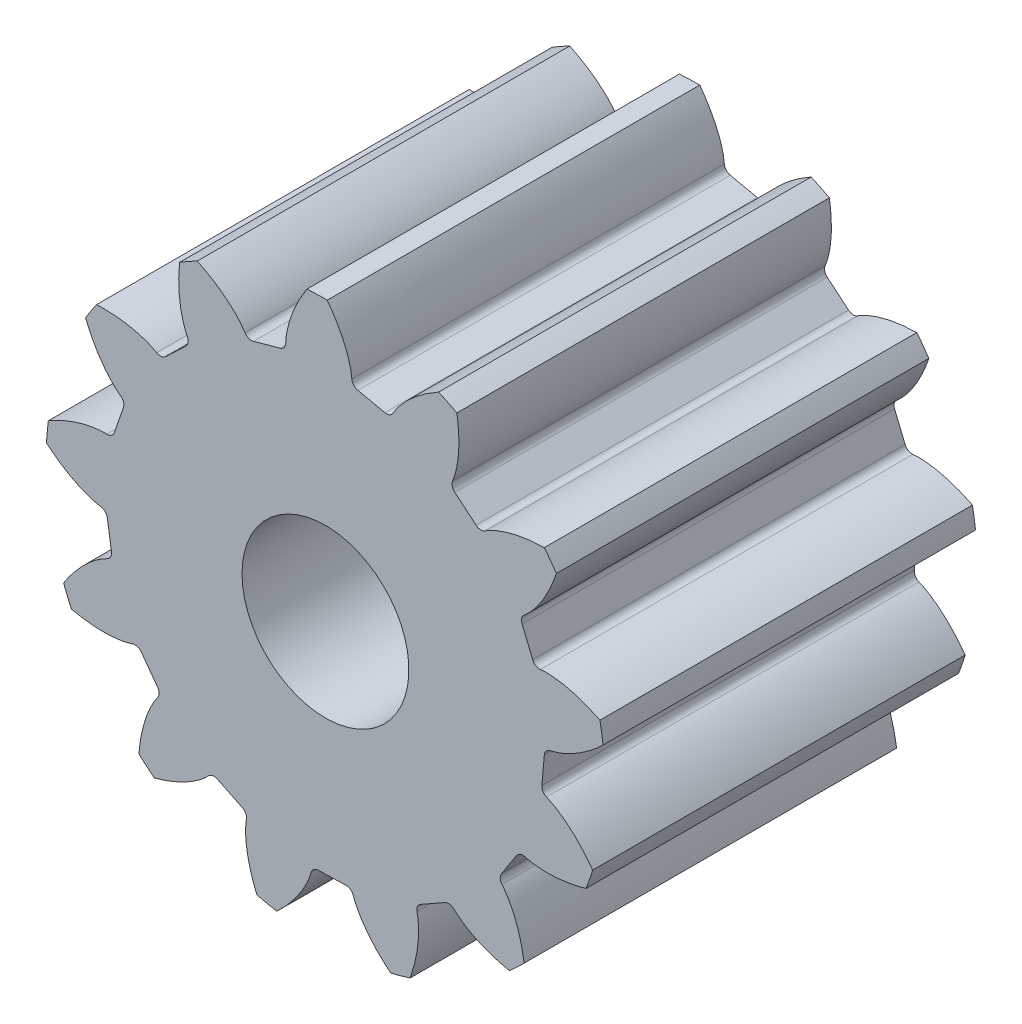
from build123d import *

# Parameters (mm, degrees)
SKETCH2_R                = 9.375
BOSS_EXTRUDE1_DEPTH      = 12.5
CUT_EXTRUDE1_DEPTH       = 12.5
FILLET1_R                = 0.254
CIRPATTERN3_COUNT        = 13
FILLET1_OF_CIRPATTERN3_R = 0.254
SKETCH3_R                = 2.8
CUT_EXTRUDE2_DEPTH       = 19.214569283


# Read off the part's stored shape, not the designer's step: Cut-Extrude1
with BuildPart() as part:
    # Sketch2 → Boss-Extrude1 (new body)
    with BuildSketch(Plane.XY):
        Circle(SKETCH2_R)
    extrude(amount=BOSS_EXTRUDE1_DEPTH)

    # Cut-Extrude1 outline → Cut-Extrude1 (cut)
    with BuildSketch(Plane.XY):
        with BuildLine():
            add(Edge.make_bspline(
                [(7.36375077, 0), (7.369196033, 0), (7.384464311, 0.000356691), (7.413295798, 0.002439252), (7.460189767, 0.007832738), (7.519640422, 0.017627369), (7.595991175, 0.033624104), (7.685169914, 0.056732319), (7.782202271, 0.086557444), (7.886545951, 0.123735009), (7.989429071, 0.164967118), (8.09080677, 0.209905809), (8.190585497, 0.258078866), (8.30989291, 0.320396761), (8.450705961, 0.400603876), (8.611688186, 0.502157362), (8.789753203, 0.626416136), (8.965954099, 0.762460936), (9.117866368, 0.889741099), (9.225406591, 0.987220267), (9.289799065, 1.047779957), (9.313674205, 1.070559573)],
                knots=[0, 0, 0, 0, 0, 0.005376748, 0.015083688, 0.02853182, 0.046610139, 0.064854849, 0.092110525, 0.119476175, 0.146842495, 0.174208853, 0.201574955, 0.228941013, 0.256307345, 0.307035032, 0.361767351, 0.41649966, 0.471231936, 0.525964281, 0.558682012, 0.558682012, 0.558682012, 0.558682012, 0.558682012], degree=4))
            Line((7.36375077, 0), (7.242514439, -1.330717849))
            add(Edge.make_bspline(
                [(8.966871537, -2.736026286), (8.947506025, -2.709307188), (8.895117565, -2.63810806), (8.806963529, -2.522799977), (8.680553382, -2.370162983), (8.531838369, -2.204516406), (8.37916005, -2.050124943), (8.239180156, -1.921152013), (8.115179827, -1.81681882), (8.009098273, -1.733966647), (7.919667745, -1.668555498), (7.828080081, -1.606036512), (7.734341957, -1.546891035), (7.638434616, -1.491469409), (7.54838955, -1.444600415), (7.464854976, -1.405756987), (7.392652058, -1.376226127), (7.335950201, -1.355849309), (7.29080296, -1.342070321), (7.262822496, -1.334811852), (7.247870052, -1.331701873), (7.242514439, -1.330717849)],
                knots=[0.350408904, 0.350408904, 0.350408904, 0.350408904, 0.350408904, 0.383126635, 0.43785898, 0.492591256, 0.547323565, 0.602055884, 0.652783571, 0.680149903, 0.707515961, 0.734882063, 0.762248421, 0.789614741, 0.816980391, 0.844236067, 0.862480777, 0.880559096, 0.894007228, 0.903714168, 0.909090916, 0.909090916, 0.909090916, 0.909090916, 0.909090916], degree=4))
            ThreePointArc((8.966871537, -2.736026286), (9.336332906, -0.850595595), (9.313674205, 1.070559573))
        make_face()
    cut_extrude1 = extrude(amount=CUT_EXTRUDE1_DEPTH, mode=Mode.SUBTRACT)

    # Fillet1
    fillet1_edges = [part.edges().sort_by_distance(p)[0] for p in [
        (7.242514439, -1.330717849, 6.25),
        (7.36375077, 0, 6.25),
    ]]
    fillet(fillet1_edges, radius=FILLET1_R)

    # CirPattern3: Cut-Extrude1 ×13 about axis
    cirpattern3_axis = Axis((0, 0, 18.908609159), (0, 0, -1))
    for i in range(1, CIRPATTERN3_COUNT):
        add(cut_extrude1.rotate(cirpattern3_axis, i * 360 / CIRPATTERN3_COUNT), mode=Mode.SUBTRACT)

    # Fillet1 of CirPattern3
    fillet1_of_cirpattern3_edges = [part.edges().sort_by_distance(p)[0] for p in [
        (5.794512631, -4.544056422, 6.25),
        (6.520277491, -3.422105616, 6.25),
        (3.019057811, -6.71640643, 6.25),
        (4.183087216, -6.060248076, 6.25),
        (-0.44802677, -7.350108666, 6.25),
        (0.887602072, -7.310060736, 6.25),
        (-3.812473818, -6.299989586, 6.25),
        (-2.61122201, -6.885226577, 6.25),
        (-6.303529059, -3.806618814, 6.25),
        (-5.511846598, -4.883069985, 6.25),
        (-7.350521758, -0.441197547, 6.25),
        (-7.149773556, -1.762260907, 6.25),
        (-6.713598506, 3.025296761, 6.25),
        (-7.149773556, 1.762260907, 6.25),
        (-4.538670744, 5.79873204, 6.25),
        (-5.511846598, 4.883069985, 6.25),
        (-1.323988211, 7.243747691, 6.25),
        (-2.61122201, 6.885226577, 6.25),
        (2.194004065, 7.029308043, 6.25),
        (0.887602072, 7.310060736, 6.25),
        (5.20937645, 5.204538634, 6.25),
        (4.183087216, 6.060248076, 6.25),
        (7.031343471, 2.187472146, 6.25),
        (6.520277491, 3.422105616, 6.25),
    ]]
    fillet(fillet1_of_cirpattern3_edges, radius=FILLET1_OF_CIRPATTERN3_R)

    # Sketch3 → Cut-Extrude2 (cut, through all)
    with BuildSketch(Plane(origin=(0, 0, 0), x_dir=(-1, 0, 0), z_dir=(0, 0, -1))):
        Circle(SKETCH3_R)
    extrude(amount=-CUT_EXTRUDE2_DEPTH, mode=Mode.SUBTRACT)


solid = part.part
